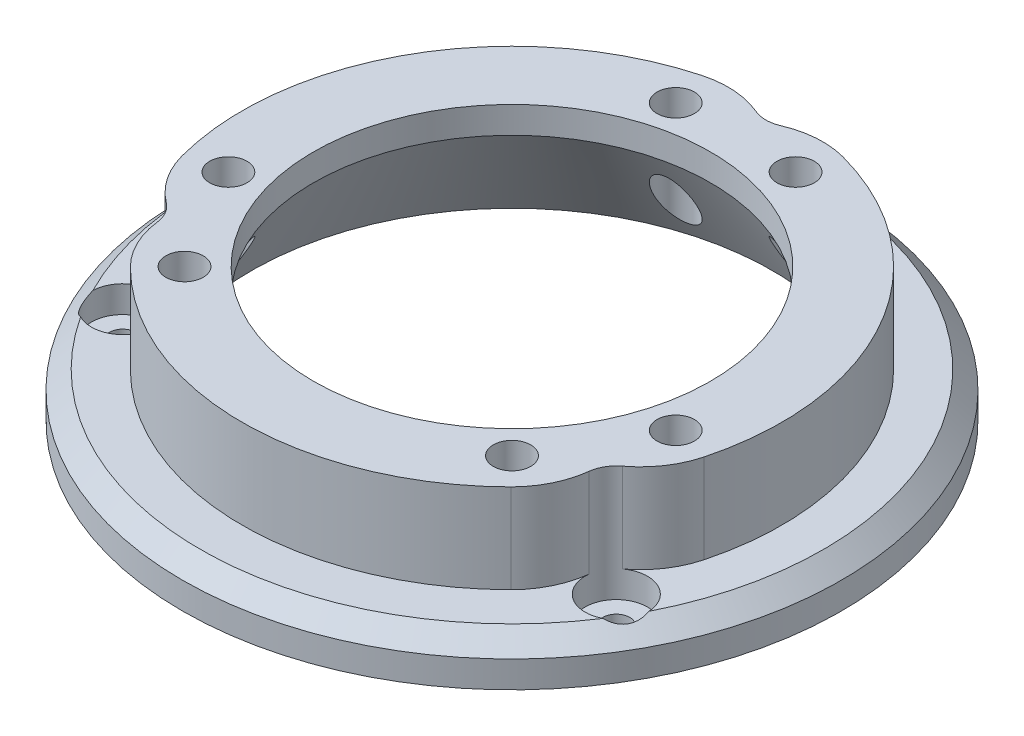
from build123d import *

# Parameters (mm, degrees)
SKETCH1_R           = 30.3
SKETCH1_R_2         = 22.3
BOSS_EXTRUDE1_DEPTH = 10
BOSS_EXTRUDE2_START = -5
SKETCH2_R           = 37
SKETCH2_R_2         = 22.3
BOSS_EXTRUDE2_DEPTH = 5
SKETCH3_R           = 1.5
CUT_EXTRUDE1_DEPTH  = 54.272882407
CUT_EXTRUDE2_START  = -3
SKETCH4_R           = 3.5
CUT_EXTRUDE2_DEPTH  = 57.272882407
CIRPATTERN1_COUNT   = 3
CHAMFER1_SIZE       = 12
CHAMFER1_SIZE2      = 6.92820323
CHAMFER2_SIZE       = 2
SKETCH5_R           = 2.1
CUT_EXTRUDE3_DEPTH  = 55.433445737
CIRPATTERN2_COUNT   = 3
FILLET1_R           = 10


with BuildPart() as part:
    # Sketch1 → Boss-Extrude1 (new body)
    with BuildSketch(Plane(origin=(0, 0, 0), x_dir=(1, 0, 0), z_dir=(0, 1, 0))):
        with Locations(Location((0, 0, 0), (0, 0, 270))):
            Circle(SKETCH1_R)
        with Locations(Location((0, 0, 0), (0, 0, 270))):
            Circle(SKETCH1_R_2, mode=Mode.SUBTRACT)
    extrude(amount=BOSS_EXTRUDE1_DEPTH)

    # Sketch2 → Boss-Extrude2 (add)
    with BuildSketch(Plane(origin=(0, 0, 0), x_dir=(1, 0, 0), z_dir=(0, 1, 0)).offset(BOSS_EXTRUDE2_START)):
        with Locations(Location((0, 0, 0), (0, 0, 270))):
            Circle(SKETCH2_R)
        with Locations(Location((0, 0, 0), (0, 0, 270))):
            Circle(SKETCH2_R_2, mode=Mode.SUBTRACT)
    extrude(amount=BOSS_EXTRUDE2_DEPTH)

    # Sketch3 → Cut-Extrude1 (cut, through all)
    with BuildSketch(Plane(origin=(0, 0, 0), x_dir=(1, 0, 0), z_dir=(0, 1, 0))):
        with Locations(Location((0, 32, 0), (0, 0, 270))):
            Circle(SKETCH3_R)
    cut_extrude1 = extrude(amount=-CUT_EXTRUDE1_DEPTH, mode=Mode.SUBTRACT)

    # Sketch4 → Cut-Extrude2 (cut)
    with BuildSketch(Plane(origin=(0, 0, 0), x_dir=(1, 0, 0), z_dir=(0, 1, 0)).offset(CUT_EXTRUDE2_START)):
        with Locations(Location((0, 32, 0), (0, 0, 328.163304996))):
            Circle(SKETCH4_R)
    cut_extrude2 = extrude(amount=CUT_EXTRUDE2_DEPTH, mode=Mode.SUBTRACT)

    # CirPattern1: Cut-Extrude1, Cut-Extrude2 ×3 about axis
    cirpattern1_axis = Axis((0, 0, 0), (0, 1, 0))
    add([cut_extrude1.rotate(cirpattern1_axis, i * 360 / CIRPATTERN1_COUNT) for i in range(1, CIRPATTERN1_COUNT)], mode=Mode.SUBTRACT)
    add([cut_extrude2.rotate(cirpattern1_axis, i * 360 / CIRPATTERN1_COUNT) for i in range(1, CIRPATTERN1_COUNT)], mode=Mode.SUBTRACT)

    # Chamfer1
    chamfer1_edges = [part.edges().sort_by_distance(p)[0] for p in [
        (0, -5, -22.3),
    ]]
    chamfer1_side = [part.faces().sort_by_distance(p)[0] for p in [
        (0, 2.5, -22.3),
    ]]
    chamfer(chamfer1_edges, length=CHAMFER1_SIZE, length2=CHAMFER1_SIZE2, reference=chamfer1_side[0])

    # Chamfer2
    # the kernel refuses this chamfer: 2 mm, written as the material it takes off along each edge
    with BuildSketch(Plane(origin=(0, 0, 0), x_dir=(0, 0, 1), z_dir=(-1, 0, 0))) as chamfer2_piece_1:
        Polygon((37, -CHAMFER2_SIZE), (37 - CHAMFER2_SIZE, 0), (37, 0), align=None)
    revolve(axis=Axis((0, 0, 0), (0, 1, 0)), mode=Mode.SUBTRACT)

    # Sketch5 → Cut-Extrude3 (cut, through all)
    with BuildSketch(Plane(origin=(0, 10, 0), x_dir=(1, 0, 0), z_dir=(0, 1, 0))):
        with Locations(Location((6.729295173, 25.114071484, 0), (0, 0, 270))):
            Circle(SKETCH5_R)
        with Locations(Location((-6.729295173, 25.114071484, 0), (0, 0, 270))):
            Circle(SKETCH5_R)
    cut_extrude3 = extrude(amount=-CUT_EXTRUDE3_DEPTH, mode=Mode.SUBTRACT)

    # CirPattern2: Cut-Extrude3 ×3 about axis
    cirpattern2_axis = Axis((0, 0, 0), (0, 1, 0))
    for i in range(1, CIRPATTERN2_COUNT):
        add(cut_extrude3.rotate(cirpattern2_axis, i * 360 / CIRPATTERN2_COUNT), mode=Mode.SUBTRACT)

    # Fillet1
    # the kernel refuses this fillet: 10 mm, written as the material it takes off along each edge
    with BuildSketch(Plane(origin=(2.973442607, 0, -30.15375), x_dir=(0.9835455418768547, 0, 0.18066036381609613), z_dir=(0, 1, 0)), Plane(origin=(-27.600634823, 0, 12.501798166), x_dir=(-0.33531630641674726, 0, -0.9421056069523365), z_dir=(0, 1, 0)), Plane(origin=(-24.627192216, 22.615356127, 17.651951834), x_dir=(0.6482292354635445, 0, 0.7614452431333121), z_dir=(0, -1, 0)), Plane(origin=(27.600634823, 22.615356127, 12.501798166), x_dir=(0.33531630641249444, 0, -0.9421056069538499), z_dir=(0, -1, 0))) as fillet1_piece_1:
        with BuildLine():
            CenterArc((4.213445677, -9.965270497), FILLET1_R, 85.223468089, 38.380201644)
            ThreePointArc((-1.321003282, -1.636412549), (-0.534685103, -0.919772386), (0, 0))
            ThreePointArc((0, 0), (2.523071225, 0.105230393), (5.046142451, 0))
        make_face()
    extrude(amount=22.615356127, mode=Mode.SUBTRACT)
    with BuildSketch(Plane(origin=(-2.973442607, 22.615356127, -30.15375), x_dir=(0.758369035624482, 0, 0.6518254412079917), z_dir=(0, -1, 0)), Plane(origin=(24.627192216, 0, 17.651951834), x_dir=(-0.18531287310344324, 0, -0.9826795708989514), z_dir=(0, 1, 0))) as fillet1_piece_2:
        with BuildLine():
            CenterArc((5.107451253, 9.538012489), FILLET1_R, 214.135867483, 38.380201644)
            ThreePointArc((-3.169640839, 3.926439938), (-1.66670095, 1.897121448), (0, 0))
            ThreePointArc((0, 0), (1.051534082, 0.161695629), (2.103068163, 0))
        make_face()
    extrude(amount=22.615356127, mode=Mode.SUBTRACT)


solid = part.part
